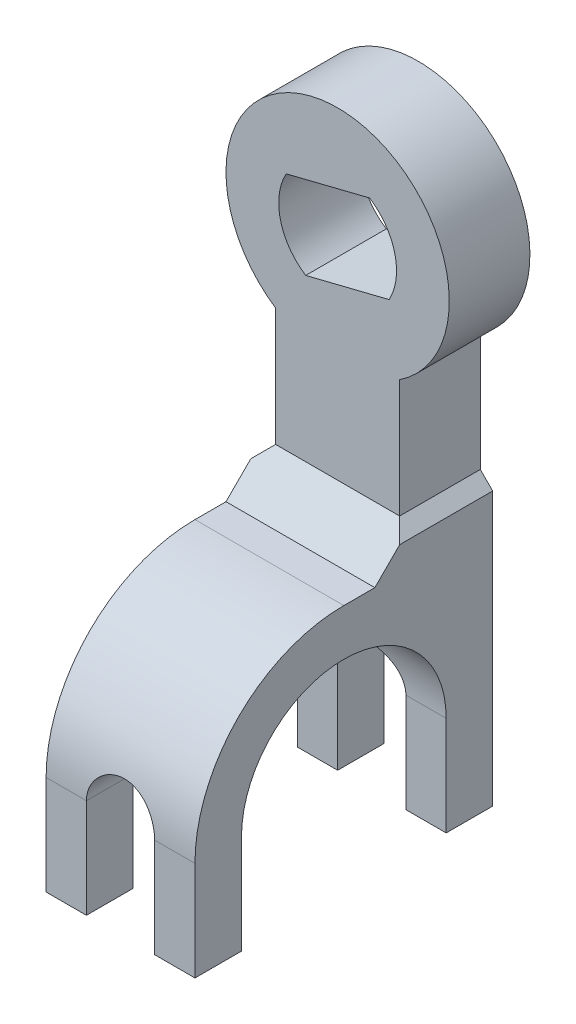
from build123d import *

# Parameters (mm, degrees)
BOSS_EXTRUDE1_DEPTH = 6.5
BOSS_EXTRUDE2_DEPTH = 6
CUT_EXTRUDE1_DEPTH  = 48.507894081
CHAMFER1_SIZE       = 3


with BuildPart() as part:
    # Sketch1 → Boss-Extrude1 (new body)
    with BuildSketch(Plane.XY):
        with BuildLine():
            Line((-5, -7.483314774), (-5, -22))
            Line((-5, -22), (5, -22))
            Line((5, -22), (5, -7.483314774))
            ThreePointArc((5, -7.483314774), (0, 9), (-5, -7.483314774))
        make_face()
        with BuildLine():
            Line((2.574956832, 3.99150314), (-4.147449153, 2.315419081))
            ThreePointArc((-4.147449153, 2.315419081), (-4.6089047, -1.149129004), (-2.574956832, -3.99150314))
            Line((-2.574956832, -3.99150314), (4.147449153, -2.315419081))
            ThreePointArc((4.147449153, -2.315419081), (4.6089047, 1.149129004), (2.574956832, 3.99150314))
        make_face(mode=Mode.SUBTRACT)
    extrude(amount=BOSS_EXTRUDE1_DEPTH)

    # Sketch2 → Boss-Extrude2 (add, symmetric)
    with BuildSketch(Plane(origin=(0, 0, 0), x_dir=(0, 0, -1), z_dir=(1, 0, 0))):
        with BuildLine():
            Line((-12, -20), (0, -20))
            Line((0, -20), (0, -40))
            Line((0, -40), (-3.75, -40))
            Line((-3.75, -40), (-3.75, -32))
            ThreePointArc((-3.75, -32), (-12, -23.75), (-20.25, -32))
            Line((-20.25, -32), (-20.25, -40))
            Line((-20.25, -40), (-24, -40))
            Line((-24, -40), (-24, -32))
            ThreePointArc((-24, -32), (-20.485281374, -23.514718626), (-12, -20))
        make_face()
    extrude(amount=BOSS_EXTRUDE2_DEPTH, both=True)

    # Sketch4 → Cut-Extrude1 (cut, through all)
    with BuildSketch(Plane.XY.offset(24)):
        with BuildLine():
            Line((-2.75, -32), (-2.75, -40))
            Line((-2.75, -40), (2.75, -40))
            Line((2.75, -40), (2.75, -32))
            ThreePointArc((2.75, -32), (0, -29.25), (-2.75, -32))
        make_face()
    extrude(amount=-CUT_EXTRUDE1_DEPTH, mode=Mode.SUBTRACT)

    # Chamfer1
    # the kernel refuses this chamfer: 3 mm, written as the material it adds along each edge
    with BuildSketch(Plane(origin=(-5, -20, 6.5), x_dir=(0.02749587661058619, 0.9996219169112968, 0), z_dir=(0, 0, -1))) as chamfer1_piece_1_section:
        Polygon((CHAMFER1_SIZE * 0.999621916911, -CHAMFER1_SIZE * 0.0274958766106), (-CHAMFER1_SIZE * 0.0274958766106, -CHAMFER1_SIZE * 0.999621916911), (0, 0), align=None)
    chamfer1_piece_1 = extrude(amount=6.5, mode=Mode.PRIVATE)
    chamfer1_piece_1 = split(chamfer1_piece_1, bisect_by=Plane(origin=(-6, -18.713879333, 3.25), z_dir=(1, 0, 0)), keep=Keep.TOP, mode=Mode.PRIVATE)
    add(chamfer1_piece_1)
    with BuildSketch(Plane(origin=(-5, -20, 6.5), x_dir=(0, -0.02749587661058678, 0.9996219169112968), z_dir=(1, 0, 0))) as chamfer1_piece_2:
        Polygon((CHAMFER1_SIZE * 0.999621916911, -CHAMFER1_SIZE * 0.0274958766106), (-CHAMFER1_SIZE * 0.0274958766106, -CHAMFER1_SIZE * 0.999621916911), (0, 0), align=None)
    extrude(amount=10)
    with BuildSketch(Plane(origin=(5, -20, 0), x_dir=(0.9996219169112968, -0.02749587661058678, 0), z_dir=(0, 0, 1))) as chamfer1_piece_3_section:
        Polygon((CHAMFER1_SIZE * 0.999621916911, CHAMFER1_SIZE * 0.0274958766106), (-CHAMFER1_SIZE * 0.0274958766106, CHAMFER1_SIZE * 0.999621916911), (0, 0), align=None)
    chamfer1_piece_3 = extrude(amount=6.5, mode=Mode.PRIVATE)
    chamfer1_piece_3 = split(chamfer1_piece_3, bisect_by=Plane(origin=(6, -18.713879333, 3.25), z_dir=(-1, 0, 0)), keep=Keep.TOP, mode=Mode.PRIVATE)
    add(chamfer1_piece_3)
    with BuildSketch(Plane(origin=(-5, -20, 14.215048964), x_dir=(0.02749587661058619, 0.9996219169112968, 0), z_dir=(0, 0, -1))) as chamfer1_piece_4a_section:
        Polygon((CHAMFER1_SIZE * 0.999621916911, -CHAMFER1_SIZE * 0.0274958766106), (-CHAMFER1_SIZE * 0.0274958766106, -CHAMFER1_SIZE * 0.999621916911), (0, 0), align=None)
    chamfer1_piece_4a = extrude(amount=14.215048964, mode=Mode.PRIVATE)
    chamfer1_piece_4a = split(chamfer1_piece_4a, bisect_by=Plane(origin=(-5.42545334, -18.713879333, 6.5), z_dir=(0, 0, 1)), keep=Keep.TOP, mode=Mode.PRIVATE)
    chamfer1_piece_4a = split(chamfer1_piece_4a, bisect_by=Plane(origin=(-6, -18.713879333, 10.357524482), z_dir=(1, 0, 0)), keep=Keep.TOP, mode=Mode.PRIVATE)
    with BuildSketch(Plane(origin=(-12.715048964, -20, 6.5), x_dir=(0, -0.02749587661058678, 0.9996219169112968), z_dir=(1, 0, 0))) as chamfer1_piece_4b_section:
        Polygon((CHAMFER1_SIZE * 0.999621916911, -CHAMFER1_SIZE * 0.0274958766106), (-CHAMFER1_SIZE * 0.0274958766106, -CHAMFER1_SIZE * 0.999621916911), (0, 0), align=None)
    chamfer1_piece_4b = extrude(amount=17.715048964, mode=Mode.PRIVATE)
    chamfer1_piece_4b = split(chamfer1_piece_4b, bisect_by=Plane(origin=(-5, -19.01061912, 7.48938088), z_dir=(-1, 0, 0)), keep=Keep.TOP, mode=Mode.PRIVATE)
    chamfer1_piece_4b = split(chamfer1_piece_4b, bisect_by=Plane(origin=(-6, -19.01061912, 7.48938088), z_dir=(1, 0, 0)), keep=Keep.TOP, mode=Mode.PRIVATE)
    chamfer1_piece_4 = chamfer1_piece_4a & chamfer1_piece_4b
    add(chamfer1_piece_4)
    with BuildSketch(Plane(origin=(5, -20, 0), x_dir=(0.9996219169112968, -0.02749587661058678, 0), z_dir=(0, 0, 1))) as chamfer1_piece_5a_section:
        Polygon((CHAMFER1_SIZE * 0.999621916911, CHAMFER1_SIZE * 0.0274958766106), (-CHAMFER1_SIZE * 0.0274958766106, CHAMFER1_SIZE * 0.999621916911), (0, 0), align=None)
    chamfer1_piece_5a = extrude(amount=14.215048964, mode=Mode.PRIVATE)
    chamfer1_piece_5a = split(chamfer1_piece_5a, bisect_by=Plane(origin=(6, -18.713879333, 10.357524482), z_dir=(-1, 0, 0)), keep=Keep.TOP, mode=Mode.PRIVATE)
    chamfer1_piece_5a = split(chamfer1_piece_5a, bisect_by=Plane(origin=(5.42545334, -18.713879333, 6.5), z_dir=(0, 0, 1)), keep=Keep.TOP, mode=Mode.PRIVATE)
    with BuildSketch(Plane(origin=(-5, -20, 6.5), x_dir=(0, -0.02749587661058678, 0.9996219169112968), z_dir=(1, 0, 0))) as chamfer1_piece_5b_section:
        Polygon((CHAMFER1_SIZE * 0.999621916911, -CHAMFER1_SIZE * 0.0274958766106), (-CHAMFER1_SIZE * 0.0274958766106, -CHAMFER1_SIZE * 0.999621916911), (0, 0), align=None)
    chamfer1_piece_5b = extrude(amount=17.715048964, mode=Mode.PRIVATE)
    chamfer1_piece_5b = split(chamfer1_piece_5b, bisect_by=Plane(origin=(6, -19.01061912, 7.48938088), z_dir=(-1, 0, 0)), keep=Keep.TOP, mode=Mode.PRIVATE)
    chamfer1_piece_5b = split(chamfer1_piece_5b, bisect_by=Plane(origin=(5, -19.01061912, 7.48938088), z_dir=(1, 0, 0)), keep=Keep.TOP, mode=Mode.PRIVATE)
    chamfer1_piece_5 = chamfer1_piece_5a & chamfer1_piece_5b
    add(chamfer1_piece_5)


solid = part.part
